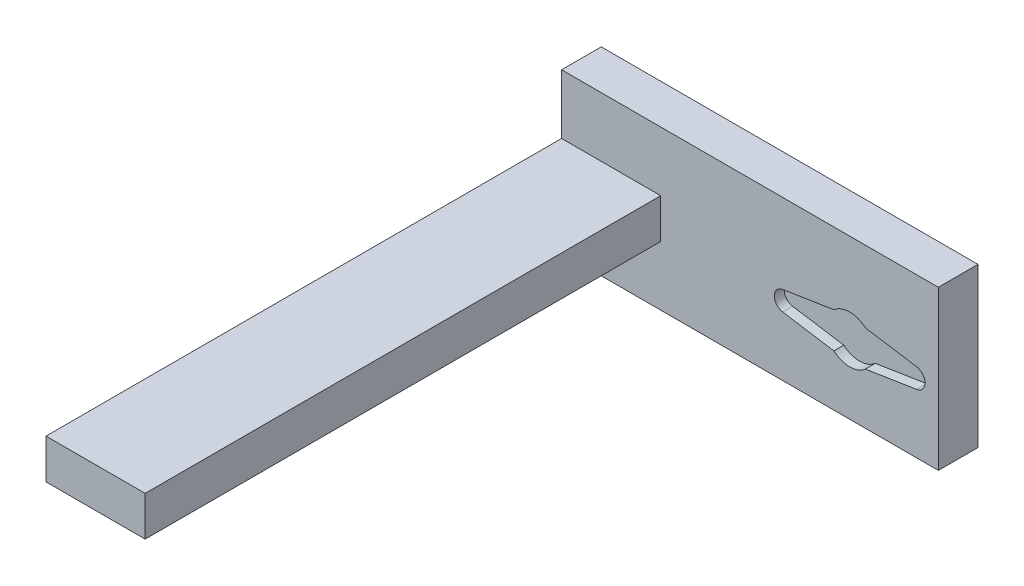
from build123d import *

# Parameters (mm, degrees)
SKETCH3_W            = 45
SKETCH3_H            = 15
BOSS_EXTRUDE1_DEPTH  = 10
CUT_EXTRUDE1_DEPTH   = 2.5
SKETCH11_W           = 45
SKETCH11_H           = 10
BOSS_EXTRUDE5_DEPTH  = 10
SKETCH14_W           = 45
SKETCH14_H           = 10
BOSS_EXTRUDE7_DEPTH  = 15
SKETCH20_W           = 10
SKETCH20_H           = 40
BOSS_EXTRUDE10_DEPTH = 50
SKETCH21_W           = 25
SKETCH21_H           = 10
BOSS_EXTRUDE11_DEPTH = 130


with BuildPart() as part:
    # Sketch3 → Boss-Extrude1 (new body)
    with BuildSketch(Plane.XY):
        with Locations((-0.138845539, 0.05888455)):
            Rectangle(SKETCH3_W, SKETCH3_H)
    extrude(amount=-BOSS_EXTRUDE1_DEPTH)

    # Sketch2 → Cut-Extrude1 (cut)
    with BuildSketch(Plane.XY):
        with BuildLine():
            Line((-16.888114198, 2.469689731), (-3.968626967, 4.5))
            ThreePointArc((-3.968626967, 4.5), (0, 6), (3.968626967, 4.5))
            Line((3.968626967, 4.5), (16.888114198, 2.469689731))
            ThreePointArc((16.888114198, 2.469689731), (19, 0), (16.888114198, -2.469689731))
            Line((16.888114198, -2.469689731), (3.968626967, -4.5))
            ThreePointArc((3.968626967, -4.5), (0, -6), (-3.968626967, -4.5))
            Line((-3.968626967, -4.5), (-16.888114198, -2.469689731))
            ThreePointArc((-16.888114198, -2.469689731), (-19, 0), (-16.888114198, 2.469689731))
        make_face()
    extrude(amount=-CUT_EXTRUDE1_DEPTH, mode=Mode.SUBTRACT)

    # Sketch11 → Boss-Extrude5 (add)
    with BuildSketch(Plane.XZ.offset(7.44111545)):
        with Locations((-0.138845539, -5)):
            Rectangle(SKETCH11_W, SKETCH11_H)
    extrude(amount=BOSS_EXTRUDE5_DEPTH)

    # Sketch14 → Boss-Extrude7 (add)
    with BuildSketch(Plane(origin=(0, 7.55888455, 0), x_dir=(1, 0, 0), z_dir=(0, 1, 0))):
        with Locations((-0.138845539, 5)):
            Rectangle(SKETCH14_W, SKETCH14_H)
    extrude(amount=BOSS_EXTRUDE7_DEPTH)

    # Sketch20 → Boss-Extrude10 (add)
    with BuildSketch(Plane.ZY.offset(22.638845539)):
        with Locations((-5, 2.55888455)):
            Rectangle(SKETCH20_W, SKETCH20_H)
    extrude(amount=BOSS_EXTRUDE10_DEPTH)

    # Sketch21 → Boss-Extrude11 (add)
    with BuildSketch(Plane.XY):
        with Locations((-60.138845539, 2.55888455)):
            Rectangle(SKETCH21_W, SKETCH21_H)
    extrude(amount=BOSS_EXTRUDE11_DEPTH)


solid = part.part
